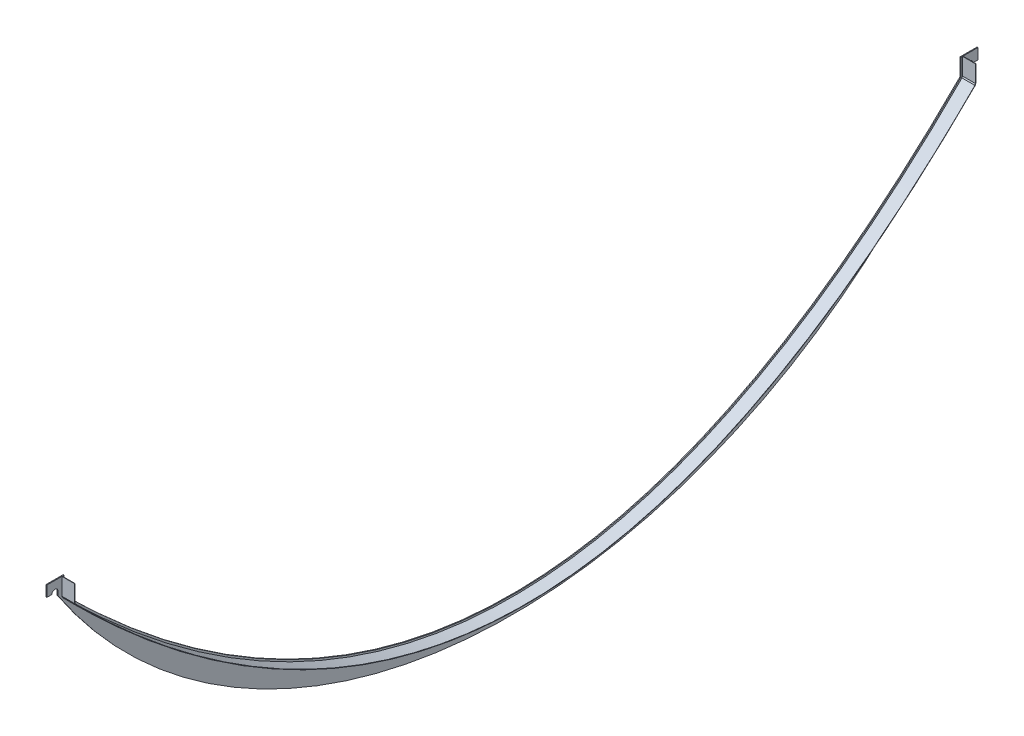
from build123d import *

# Parameters (mm, degrees)
BOSS_EXTRUDE1_DEPTH = 2.54
EXTRUDE_THIN1_DEPTH = 38.1


# Read off the part's stored shape, not the designer's step: Extrude-Thin1
with BuildPart() as part:
    # Sketch60 → Boss-Extrude1 (new body)
    with BuildSketch(Plane(origin=(0, 0, 0), x_dir=(0, 0, -1), z_dir=(1, 0, 0))):
        with BuildLine():
            Line((1327.15, 331.787470833), (1327.15, 382.587350833))
            Line((1327.15, 382.587350833), (1377.950002406, 382.587350833))
            Line((1377.950002406, 382.587350833), (1377.950002406, 350.761150833))
            Line((1377.950002406, 350.761150833), (1363.014798129, 350.761150833))
            ThreePointArc((1363.014798129, 350.761150833), (1354.048599065, 359.727349897), (1345.0824, 350.761150833))
            Line((1345.0824, 350.761150833), (1345.0824, 338.838562796))
            ThreePointArc((1345.0824, 338.838562796), (0, -382.587529167), (-1345.0824, 338.838562795))
            Line((-1345.0824, 338.838562795), (-1345.0824, 350.761150833))
            ThreePointArc((-1345.0824, 350.761150833), (-1354.048599065, 359.727349897), (-1363.014798129, 350.761150833))
            Line((-1363.014798129, 350.761150833), (-1377.950002406, 350.761150833))
            Line((-1377.950002406, 350.761150833), (-1377.950002406, 382.587350833))
            Line((-1377.950002406, 382.587350833), (-1327.15, 382.587350833))
            Line((-1327.15, 382.587350833), (-1327.15, 331.787470833))
            add(Edge.make_bspline(
                [(1327.15, 331.787470833), (1e-09, -995.362529167), (-1327.15, 331.787470833)],
                knots=[0, 0, 0, 1, 1, 1], degree=2))
        make_face()
    extrude(amount=BOSS_EXTRUDE1_DEPTH)

    # Extrude-Thin1 outline → Extrude-Thin1 (add)
    with BuildSketch(Plane(origin=(2.54, 0, 0), x_dir=(0, 0, -1), z_dir=(1, 0, 0))):
        with BuildLine():
            add(Edge.make_bspline(
                [(1331.64012806, 327.297342772), (1220.857206072, 216.514420784), (1110.039266695, 119.543483359), (888.305733392, -46.756666627), (777.389280582, -116.086154697), (555.440332256, -227.060628875), (444.406603679, -268.704745917), (222.248599022, -324.244247103), (111.125000161, -338.137529152), (-111.124999809, -338.137529182), (-222.24859867, -324.244247162), (-444.406603328, -268.704746034), (-555.440331905, -227.060629021), (-777.389280231, -116.086154902), (-888.305733041, -46.756666861), (-1110.039266345, 119.543483066), (-1220.857205722, 216.514420463), (-1331.64012771, 327.297342421)],
                knots=[0, 0, 0, 0, 0.125, 0.125, 0.25, 0.25, 0.375, 0.375, 0.5, 0.5, 0.625, 0.625, 0.75, 0.75, 0.875, 0.875, 1, 1, 1, 1], degree=3))
            Line((1331.64012806, 327.297342772), (1333.5, 331.787470833))
            Line((1333.5, 331.787470833), (1333.5, 382.587350833))
            Line((1333.5, 382.587350833), (1332.23, 382.587350833))
            Line((1332.23, 382.587350833), (1332.23, 332.04008954))
            Line((1332.23, 332.04008954), (1330.563482535, 328.016760475))
            add(Edge.make_bspline(
                [(1330.563482535, 328.016760475), (1219.832830837, 217.300990844), (1109.074174075, 120.39600204), (887.478733858, -45.778240912), (776.641272659, -115.047704785), (554.873550579, -225.916661245), (443.942272952, -267.515471252), (222.0073883, -322.991733554), (111.004224806, -336.867529153), (-111.004224472, -336.867529181), (-222.007387967, -322.991733609), (-443.942272618, -267.515471364), (-554.873550246, -225.916661384), (-776.641272326, -115.047704979), (-887.478733526, -45.778241134), (-1109.074173743, 120.396001763), (-1219.832830505, 217.300990539), (-1330.563482203, 328.016760142)],
                knots=[0, 0, 0, 0, 0.125, 0.125, 0.25, 0.25, 0.375, 0.375, 0.5, 0.5, 0.625, 0.625, 0.75, 0.75, 0.875, 0.875, 1, 1, 1, 1], degree=3))
            Line((-1330.563482203, 328.016760142), (-1332.23, 332.040089565))
            Line((-1332.23, 332.040089565), (-1332.23, 382.587350833))
            Line((-1332.23, 382.587350833), (-1333.5, 382.587350833))
            Line((-1333.5, 382.587350833), (-1333.5, 331.787470833))
            Line((-1333.5, 331.787470833), (-1331.64012771, 327.297342421))
        make_face()
    extrude(amount=EXTRUDE_THIN1_DEPTH)


solid = part.part
